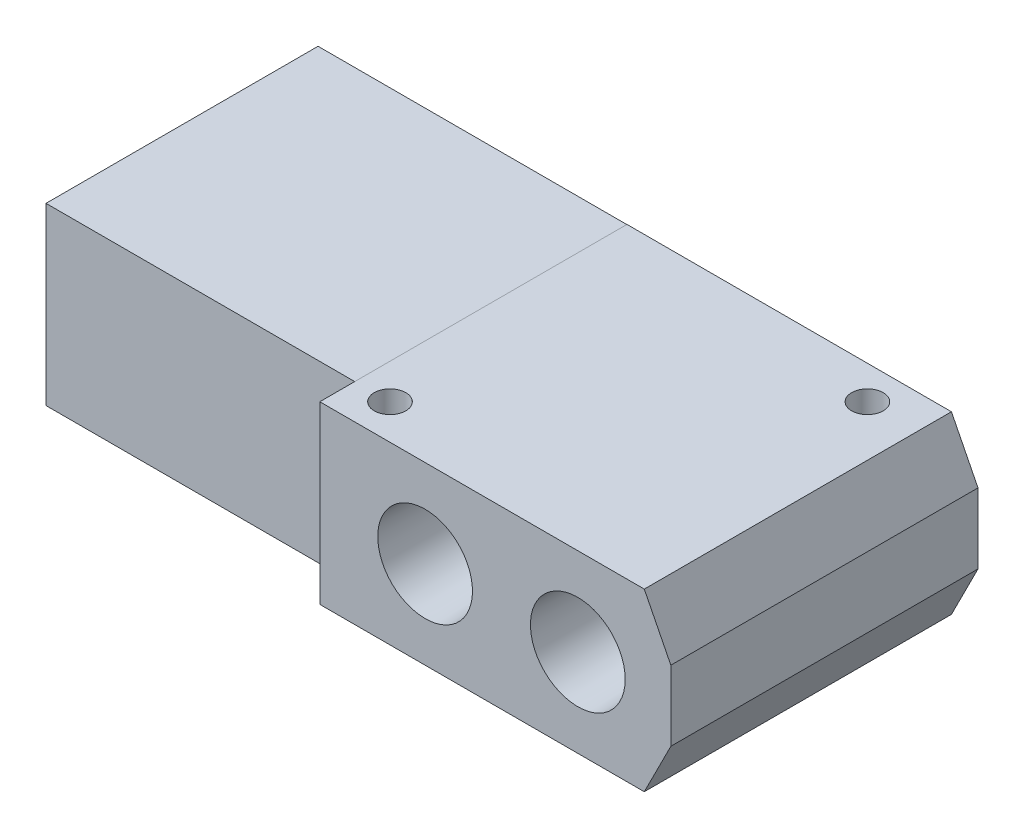
from build123d import *

# Parameters (mm, degrees)
BOSS_EXTRUDE1_DEPTH = 25.4
SKETCH2_W           = 44.704
SKETCH2_H           = 0.0254
CUT_EXTRUDE1_DEPTH  = 107.377492525
SKETCH3_R           = 2.286
CUT_EXTRUDE2_DEPTH  = 107.377492525
CUT_EXTRUDE3_DEPTH  = 109.360401051


# Read off the part's stored shape, not the designer's step: 1/4 NPT Tapped Hole1
with BuildPart() as part:
    # Sketch1 → Boss-Extrude1 (new body)
    with BuildSketch(Plane(origin=(0, 0, 0), x_dir=(1, 0, 0), z_dir=(0, 1, 0))):
        Polygon((44.704, -5.08), (95.504, -5.08), (95.504, 39.37), (0, 39.37), (0, 0), (44.704, 0), align=None)
    extrude(amount=BOSS_EXTRUDE1_DEPTH)

    # Sketch2 → Cut-Extrude1 (cut, through all)
    with BuildSketch(Plane.XY):
        with Locations((22.352, 25.3873)):
            Rectangle(SKETCH2_W, SKETCH2_H)
        with Locations((22.352, 0.0127)):
            Rectangle(SKETCH2_W, SKETCH2_H)
    extrude(amount=-CUT_EXTRUDE1_DEPTH, mode=Mode.SUBTRACT)

    # Sketch3 → Cut-Extrude2 (cut, through all)
    with BuildSketch(Plane(origin=(0, 25.4, 0), x_dir=(1, 0, 0), z_dir=(0, 1, 0))):
        with Locations(Location((49.784, 0, 0), (0, 0, 270))):
            Circle(SKETCH3_R)
        with Locations(Location((84.328, 34.544, 0), (0, 0, 270))):
            Circle(SKETCH3_R)
    extrude(amount=-CUT_EXTRUDE2_DEPTH, mode=Mode.SUBTRACT)

    # 1/4 NPT Tapped Hole1 outline → 1/4 NPT Tapped Hole1 (revolve, cut)
    with BuildSketch(Plane(origin=(69.85, 12.7, 0), x_dir=(1, 0, 0), z_dir=(0, -1, 0))):
        Polygon((5.5626, -22.352), (0, -19.009652721), (0, -39.37), (6.8545837, -39.37), (6.557984794, -29.464), (5.5626, -29.464), align=None)
    revolve(axis=Axis((69.85, 12.7, 0), (0, 0, 1)), mode=Mode.SUBTRACT)

    # 1_4 NPT Tapped Hole1 2 outline → 1_4 NPT Tapped Hole1 2 (revolve, cut)
    with BuildSketch(Plane(origin=(82.042, 12.7, 0), x_dir=(1, 0, 0), z_dir=(0, -1, 0))):
        Polygon((0, 5.08), (0, -15.280347279), (5.5626, -11.938), (5.5626, -4.826), (6.557984794, -4.826), (6.8545837, 5.08), align=None)
    revolve(axis=Axis((82.042, 12.7, 0), (0, 0, 1)), mode=Mode.SUBTRACT)

    # 1_4 NPT Tapped Hole1 3 outline → 1_4 NPT Tapped Hole1 3 (revolve, cut)
    with BuildSketch(Plane(origin=(59.944, 12.7, 0), x_dir=(1, 0, 0), z_dir=(0, -1, 0))):
        Polygon((6.8545837, 5.08), (0, 5.08), (0, -15.280347279), (5.5626, -11.938), (5.5626, -4.826), (6.557984794, -4.826), align=None)
    revolve(axis=Axis((59.944, 12.7, 0), (0, 0, 1)), mode=Mode.SUBTRACT)

    # Sketch7 → Cut-Extrude3 (cut, through all)
    with BuildSketch(Plane.XY.offset(5.08)):
        Polygon((95.504, 25.4), (95.504, 17.78), (91.660260387, 25.4), align=None)
        Polygon((91.660260387, 0), (95.504, 0), (95.504, 7.62), align=None)
    extrude(amount=-CUT_EXTRUDE3_DEPTH, mode=Mode.SUBTRACT)


solid = part.part
